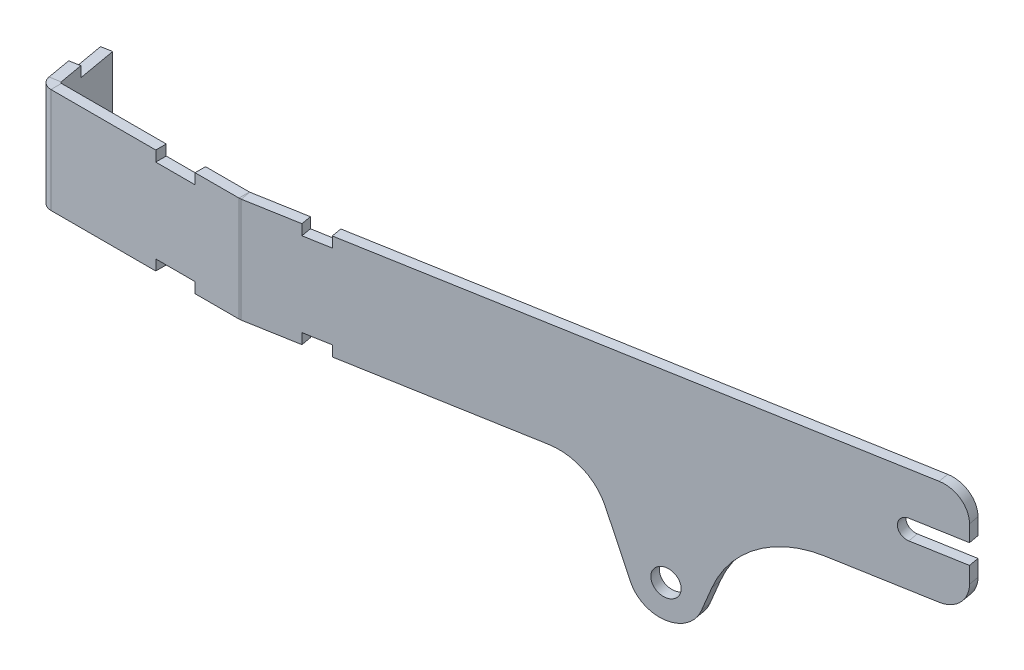
from build123d import *

# Parameters (mm, degrees)
SKETCH1_W               = 431.8
SKETCH1_H               = 50.8
BASE_FLANGE1_DEPTH      = 5.08
SKETCHED_START          = -25.4
SKETCHED_BEND1_DEPTH    = 50.8
SKETCHED_BEND1_2_DEPTH  = 50.8
SKETCHED_BEND2_DEPTH    = 50.8
SKETCHED_BEND2_2_DEPTH  = 50.8
SKETCH9_W               = 19.05
SKETCH9_H               = 5.08
CUT_EXTRUDE1_DEPTH      = 220.697648588
SKETCH10_W              = 19.05
SKETCH10_H              = 5.08
CUT_EXTRUDE2_DEPTH      = 398.423928706
SKETCH11_W              = 12.7
SKETCH11_H              = 5.08
CUT_EXTRUDE3_DEPTH      = 221.091320007
FILLET1_R               = 12.7
CUT_EXTRUDE4_DEPTH      = 221.036222152
CUT_EXTRUDE4_DEPTH_BACK = 221.036222152
SKETCH12_R              = 4.7625
SKETCH14_R              = 6.35
BOSS_EXTRUDE1_DEPTH     = 5.08
FILLET2_R               = 50.8
FILLET3_R               = 25.4


# Read off the part's stored shape, not the designer's step: Sketched Bend1, Sketched Bend2
# Sheet-metal steps are written as plain solids
with BuildPart() as part:
    # Sketch1 → Base-Flange1 (new body)
    with BuildSketch(Plane.XY):
        Rectangle(SKETCH1_W, SKETCH1_H)
    extrude(amount=-BASE_FLANGE1_DEPTH)

    # Sketched Bend1 outline → Sketched Bend1 (cut)
    with BuildSketch(Plane(origin=(0, 0, 0), x_dir=(1, 0, 0), z_dir=(0, 1, 0)).offset(SKETCHED_START)):
        with BuildLine():
            Line((-186.267525861, 4.80655801), (-186.315741061, 5.08))
            Line((-186.315741061, 5.08), (-215.9, 5.08))
            Line((-215.9, 5.08), (-215.9, 0))
            Line((-215.9, 0), (-180.539293085, 0))
            ThreePointArc((-180.539293085, 0), (-184.278131496, 1.360825892), (-186.267525861, 4.80655801))
        make_face()
    extrude(amount=SKETCHED_BEND1_DEPTH, mode=Mode.SUBTRACT)

    # Sketched Bend1 2 outline → Sketched Bend1 2 (add)
    with BuildSketch(Plane(origin=(0, 0, 0), x_dir=(1, 0, 0), z_dir=(0, 1, 0)).offset(SKETCHED_START)):
        with BuildLine():
            Line((-181.264702476, 5.688690752), (-186.61058496, 36.006696892))
            Line((-186.61058496, 36.006696892), (-191.613408345, 35.124564149))
            Line((-191.613408345, 35.124564149), (-186.315741061, 5.08))
            Line((-186.315741061, 5.08), (-180.539293085, 5.08))
            ThreePointArc((-180.539293085, 5.08), (-181.012770439, 5.252331663), (-181.264702476, 5.688690752))
        make_face()
    extrude(amount=SKETCHED_BEND1_2_DEPTH)

    # Sketched Bend2 outline → Sketched Bend2 (cut)
    with BuildSketch(Plane(origin=(0, 0, 0), x_dir=(1, 0, 0), z_dir=(0, 1, 0)).offset(SKETCHED_START)):
        with BuildLine():
            Line((215.9, 5.08), (-60.089888357, 5.08))
            Line((-60.089888357, 5.08), (-88.39884457, 0.088367224))
            ThreePointArc((-88.39884457, 0.088367224), (-88.901936467, 0.022133919), (-89.40888656, 0))
            Line((-89.40888656, 0), (215.9, 0))
            Line((215.9, 0), (215.9, 5.08))
        make_face()
    extrude(amount=SKETCHED_BEND2_DEPTH, mode=Mode.SUBTRACT)

    # Sketched Bend2 2 outline → Sketched Bend2 2 (add)
    with BuildSketch(Plane(origin=(0, 0, 0), x_dir=(1, 0, 0), z_dir=(0, 1, 0)).offset(SKETCHED_START)):
        with BuildLine():
            Line((210.826394713, 58.008217407), (-89.280977313, 5.091190609))
            ThreePointArc((-89.280977313, 5.091190609), (-89.34468764, 5.082802985), (-89.40888656, 5.08))
            Line((-89.40888656, 5.08), (-60.089888357, 5.08))
            Line((-60.089888357, 5.08), (211.708527455, 53.005394021))
            Line((211.708527455, 53.005394021), (210.826394713, 58.008217407))
        make_face()
    extrude(amount=SKETCHED_BEND2_2_DEPTH)

    # Sketch9 → Cut-Extrude1 (cut, through all)
    with BuildSketch(Plane(origin=(0, 0, -5.08), x_dir=(-1, 0, 0), z_dir=(0, 0, -1))):
        with Locations((120.214293085, 22.86)):
            Rectangle(SKETCH9_W, SKETCH9_H)
    cut_extrude1 = extrude(amount=-CUT_EXTRUDE1_DEPTH, mode=Mode.SUBTRACT)

    # Sketch10 → Cut-Extrude2 (cut, through all)
    with BuildSketch(Plane(origin=(-174.826079488, 0, 30.826554745), x_dir=(-0.17364817766692736, 0, -0.9848077530122086), z_dir=(0.9848077530122086, 0, -0.17364817766692736))):
        with Locations((58.339262271, 22.86)):
            Rectangle(SKETCH10_W, SKETCH10_H)
    cut_extrude2 = extrude(amount=-CUT_EXTRUDE2_DEPTH, mode=Mode.SUBTRACT)

    # Sketch11 → Cut-Extrude3 (cut, through all)
    with BuildSketch(Plane(origin=(-2.680663006, 0, -15.202795371), x_dir=(0.9848077530122081, 0, -0.17364817766693072), z_dir=(0.17364817766693072, 0, 0.9848077530122081))):
        with Locations((-55.290522683, 22.86)):
            Rectangle(SKETCH11_W, SKETCH11_H)
    cut_extrude3 = extrude(amount=-CUT_EXTRUDE3_DEPTH, mode=Mode.SUBTRACT)

    # Mirror1: Cut-Extrude1, Cut-Extrude2, Cut-Extrude3 across plane
    add(cut_extrude1.mirror(Plane.ZX), mode=Mode.SUBTRACT)
    add(cut_extrude2.mirror(Plane.ZX), mode=Mode.SUBTRACT)
    add(cut_extrude3.mirror(Plane.ZX), mode=Mode.SUBTRACT)

    # Fillet1
    fillet1_edges = [part.edges().sort_by_distance(p)[0] for p in [
        (211.267461084, 25.4, -55.506805714),
        (211.267461084, -25.4, -55.506805714),
    ]]
    fillet(fillet1_edges, radius=FILLET1_R)

    # Sketch12 → Cut-Extrude4 (cut, two sides: drawn at the far end of the back side and taken through both)
    with BuildSketch(Plane(origin=(-3.562795749, 0, -20.205618756), x_dir=(-0.9848077530122081, 0, 0.17364817766693072), z_dir=(-0.17364817766693072, 0, -0.9848077530122081)).offset(-CUT_EXTRUDE4_DEPTH_BACK)):
        with BuildLine():
            ThreePointArc((-192.296489295, -4.7625), (-197.058989295, 0), (-192.296489295, 4.7625))
            Line((-192.296489295, 4.7625), (-217.696489295, 4.7625))
            Line((-217.696489295, 4.7625), (-217.696489295, -4.7625))
            Line((-217.696489295, -4.7625), (-192.296489295, -4.7625))
        make_face()
        with Locations((-192.296489295, 0)):
            Circle(SKETCH12_R)
    extrude(amount=CUT_EXTRUDE4_DEPTH + CUT_EXTRUDE4_DEPTH_BACK, mode=Mode.SUBTRACT)

    # Sketch14 → Boss-Extrude1 (add)
    with BuildSketch(Plane(origin=(-3.562795749, 0, -20.205618756), x_dir=(-0.9848077530122081, 0, 0.17364817766693072), z_dir=(-0.17364817766693072, 0, -0.9848077530122081))):
        with BuildLine():
            Line((-75.889552591, -69.224530587), (-58.946489295, -25.4))
            Line((-58.946489295, -25.4), (-122.446489295, -25.4))
            Line((-122.446489295, -25.4), (-105.503425999, -69.224530587))
            ThreePointArc((-105.503425999, -69.224530587), (-90.696489295, -79.375), (-75.889552591, -69.224530587))
        make_face()
        with Locations((-90.696489295, -63.5)):
            Circle(SKETCH14_R, mode=Mode.SUBTRACT)
    extrude(amount=-BOSS_EXTRUDE1_DEPTH)

    # Fillet2
    fillet2_edges = [part.edges().sort_by_distance(p)[0] for p in [
        (117.46452261, -25.4, -38.966816791),
    ]]
    fillet(fillet2_edges, radius=FILLET2_R)

    # Fillet3
    # the kernel refuses this fillet: 25.4 mm, written as the material it adds along each edge
    with BuildSketch(Plane(origin=(54.488163922, -25.4, -30.441569202), x_dir=(0.35512202231381235, -0.9327204223089547, -0.06261759397767878), z_dir=(0.17364817766693072, 0, 0.9848077530122081))) as fillet3_piece_1:
        with BuildLine():
            CenterArc((FILLET3_R * 0.685521226707, -FILLET3_R), FILLET3_R, 90, 68.862929738)
            Line((-FILLET3_R * 0.247199195602, -FILLET3_R * 0.639399648076), (0, 0))
            Line((0, 0), (FILLET3_R * 0.685521226707, 0))
        make_face()
    extrude(amount=5.08)


solid = part.part
